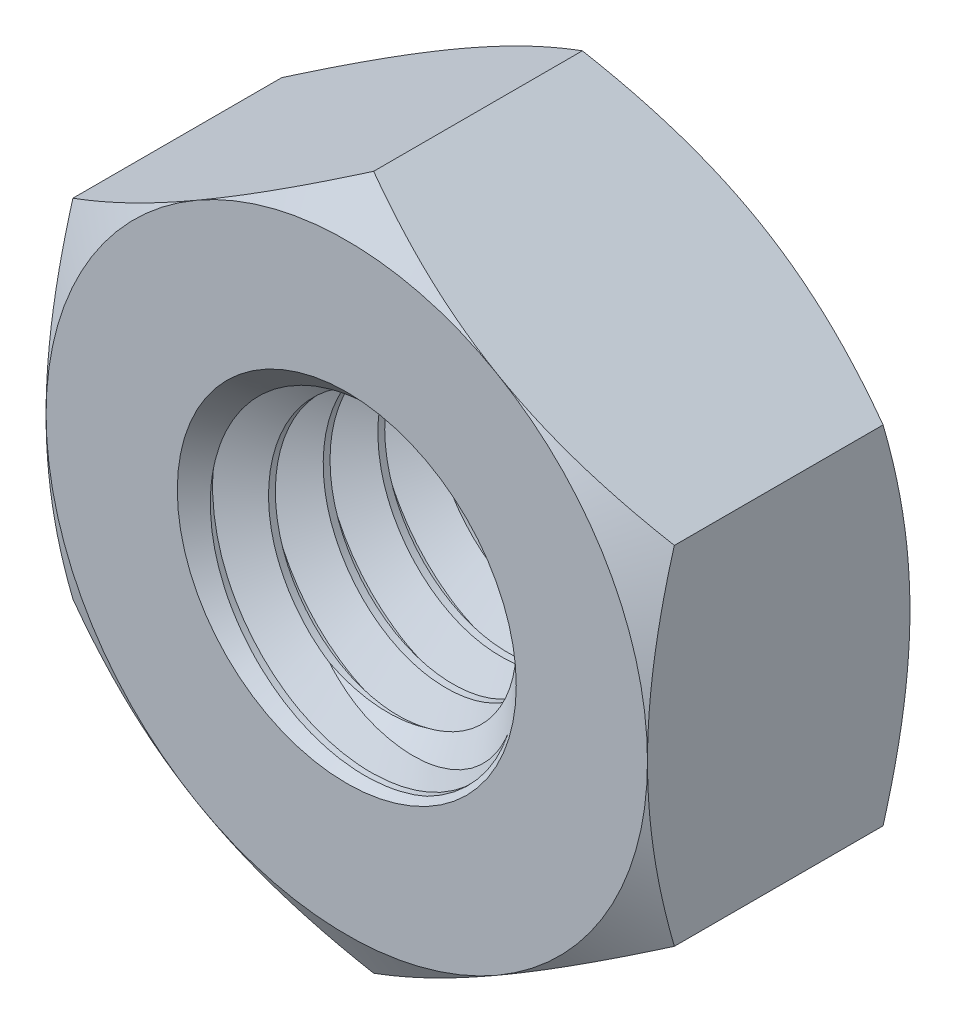
from build123d import *

# Parameters (mm, degrees)
EXTRUDE1_DEPTH               = 1.2
SKETCH13_R                   = 1.5
BOSS_EXTRUDE1_DEPTH          = 2.4
SKETCH7_OUTSIDE_W            = 97.236
SKETCH7_OUTSIDE_H            = 98.086
SKETCH7_OUTSIDE_R            = 2.75
EXTRUDE2_DEPTH               = 25.4
EXTRUDE2_DRAFT               = -60
MIRROR2_COPY_1_SKETCH_W      = 97.236
MIRROR2_COPY_1_SKETCH_H      = 98.086
MIRROR2_COPY_1_SKETCH_R      = 2.75
MIRROR2_COPY_1_DEPTH         = 25.4
MIRROR2_COPY_1_DRAFT         = -60
SWEEP1_PITCH                 = 0.5
SKETCH15_R                   = 1.55
CUT_EXTRUDE4_OTHER_WAY_DEPTH = 6.104590001
CUT_EXTRUDE4_OTHER_WAY_TAPER = -45
SKETCH16_R                   = 1.55
CUT_EXTRUDE5_OTHER_WAY_DEPTH = 5.837957664
CUT_EXTRUDE5_OTHER_WAY_TAPER = -45


with BuildPart() as part:
    # Sketch1 → Extrude1 (new, symmetric)
    with BuildSketch(Plane.XY):
        Polygon((-2.75, 1.58771324), (-2.75, -1.58771324), (0, -3.175426481), (2.75, -1.58771324), (2.75, 1.58771324), (0, 3.175426481), align=None)
    extrude(amount=EXTRUDE1_DEPTH, both=True)

    # Cut-Extrude2 cone 1 section (through the dimple's axis) → Cut-Extrude2 (revolve, cut)
    with BuildSketch(Plane(origin=(0, 0, 1.2), x_dir=(0, -1, 0), z_dir=(1, 0, 0))):
        Polygon((0, 0), (1.5, 0), (0, 1.5), align=None)
    revolve(axis=Axis((0, 0, 1.2), (0, 0, -1)), mode=Mode.SUBTRACT)

    # Cut-Extrude3 cone 1 section (through the dimple's axis) → Cut-Extrude3 (revolve, cut)
    with BuildSketch(Plane(origin=(0, 0, -1.2), x_dir=(0, 1, 0), z_dir=(1, 0, 0))):
        Polygon((0, 0), (1.5, 0), (0, 1.5), align=None)
    revolve(axis=Axis((0, 0, -1.2), (0, 0, 1)), mode=Mode.SUBTRACT)


with BuildPart() as body_2:
    # Sketch13 → Boss-Extrude1 (new body)
    with BuildSketch(Plane(origin=(0, 0, -1.2), x_dir=(-1, 0, 0), z_dir=(0, 0, -1))):
        Circle(SKETCH13_R)
    extrude(amount=-BOSS_EXTRUDE1_DEPTH)


with BuildPart() as part_1:
    add(part.part)

    # Combine1: cut body 2
    add(body_2.part, mode=Mode.SUBTRACT)


with BuildPart() as extrude2_tool:
    # Sketch7 outside → Extrude2 (with draft: the straight prism first)
    with BuildSketch(Plane.XY.offset(1.2)):
        Rectangle(SKETCH7_OUTSIDE_W, SKETCH7_OUTSIDE_H)
        Circle(SKETCH7_OUTSIDE_R, mode=Mode.SUBTRACT)
    extrude(amount=-EXTRUDE2_DEPTH)
    # Extrude2: the draft: its side faces are tilted about the plane it starts from
    extrude2_sides = [extrude2_tool.faces().sort_by_distance(p)[0] for p in [
        (0, -49.043, -11.5),
        (48.618, 0, -11.5),
        (0, 49.043, -11.5),
        (-48.618, 0, -11.5),
        (-2.75, 0, -11.5),
    ]]
    draft(extrude2_sides, Plane.XY.offset(1.2), EXTRUDE2_DRAFT)


with BuildPart() as part_2:
    add(part_1.part)

    # Extrude2: cut by extrude2_tool
    add(extrude2_tool.part, mode=Mode.SUBTRACT)


with BuildPart() as mirror2_copy_1_tool:
    # Mirror2 copy 1 sketch → Mirror2 copy 1 (with draft: the straight prism first)
    with BuildSketch(Plane(origin=(0, 0, -1.2), x_dir=(1, 0, 0), z_dir=(0, 0, -1))):
        Rectangle(MIRROR2_COPY_1_SKETCH_W, MIRROR2_COPY_1_SKETCH_H)
        Circle(MIRROR2_COPY_1_SKETCH_R, mode=Mode.SUBTRACT)
    extrude(amount=-MIRROR2_COPY_1_DEPTH)
    # Mirror2 copy 1: the draft: its side faces are tilted about the plane it starts from
    mirror2_copy_1_sides = [mirror2_copy_1_tool.faces().sort_by_distance(p)[0] for p in [
        (0, -49.043, 11.5),
        (48.618, 0, 11.5),
        (0, 49.043, 11.5),
        (-48.618, 0, 11.5),
        (-2.75, 0, 11.5),
    ]]
    draft(mirror2_copy_1_sides, Plane(origin=(0, 0, -1.2), x_dir=(1, 0, 0), z_dir=(0, 0, -1)), MIRROR2_COPY_1_DRAFT)


with BuildPart() as part_3:
    add(part_2.part)

    # Mirror2 copy 1: cut by mirror2_copy_1_tool
    add(mirror2_copy_1_tool.part, mode=Mode.SUBTRACT)

    # Sweep1: the profile of Sketch12 profile screwed along a right-hand helix of 5.8 turns, 6 arcs to a turn; built about Z, then put on its axis
    sweep1_z = Axis((0, 0, 0), (0, 0, 1))
    sweep1_corners = [(1.5003, 0, -0.437673205), (1.5003, 0, 0.000173205), (1.175240474, 0, -0.1875), (1.175240474, 0, -0.25)]
    with BuildLine(mode=Mode.PRIVATE) as sweep1_profile:
        Line(sweep1_corners[0], sweep1_corners[1])
        Line(sweep1_corners[1], sweep1_corners[2])
        Line(sweep1_corners[2], sweep1_corners[3])
        Line(sweep1_corners[3], sweep1_corners[0])
    sweep1_cap = Face(sweep1_profile.wire())
    sweep1_turn_angles = [0, 30, 60, 90, 120, 150, 180, 210, 240, 270, 300, 330, 360]
    sweep1_turn_weights = [1, 0.8660254037844387, 1, 0.8660254037844387, 1, 0.8660254037844387, 1, 0.8660254037844387, 1, 0.8660254037844387, 1, 0.8660254037844387, 1]
    sweep1_turn_rails = [Edge.make_bspline([Vector(p[0], p[1], 0).rotate(sweep1_z, sweep1_turn_angles[k]) / sweep1_turn_weights[k] + Vector(0, 0, p[2] + SWEEP1_PITCH * sweep1_turn_angles[k] / 360) for k in range(13)], [0, 0, 0, 1, 1, 2, 2, 3, 3, 4, 4, 5, 5, 6, 6, 6], 2, sweep1_turn_weights) for p in sweep1_corners]
    sweep1_turn_sides = [Face.make_surface_from_curves(sweep1_turn_rails[p[0]], sweep1_turn_rails[p[1]]) for p in [(0, 1), (1, 2), (2, 3), (3, 0)]]
    sweep1_last_angles = [1800, 1830, 1860, 1890, 1920, 1950, 1980, 2010, 2040, 2064, 2088]
    sweep1_last_weights = [1, 0.8660254037844387, 1, 0.8660254037844387, 1, 0.8660254037844387, 1, 0.8660254037844387, 1, 0.9135454576425831, 1]
    sweep1_last_rails = [Edge.make_bspline([Vector(p[0], p[1], 0).rotate(sweep1_z, sweep1_last_angles[k]) / sweep1_last_weights[k] + Vector(0, 0, p[2] + SWEEP1_PITCH * sweep1_last_angles[k] / 360) for k in range(11)], [0, 0, 0, 1, 1, 2, 2, 3, 3, 4, 4, 5, 5, 5], 2, sweep1_last_weights) for p in sweep1_corners]
    sweep1_last_sides = [Face.make_surface_from_curves(sweep1_last_rails[p[0]], sweep1_last_rails[p[1]]) for p in [(0, 1), (1, 2), (2, 3), (3, 0)]]
    sweep1 = Plane(origin=(0, 0, -1.2), x_dir=(0, 1, 0), z_dir=(0, 0, 1)) * Solid(Shell([*[p.moved(Location((0, 0, SWEEP1_PITCH * i))) for i in range(5) for p in sweep1_turn_sides], *sweep1_last_sides, sweep1_cap, sweep1_cap.rotate(sweep1_z, 2088).moved(Location((0, 0, SWEEP1_PITCH * 2088 / 360)))]))
    add(sweep1)

    # Cut-Extrude4 cone 1 section (through the dimple's axis) → Cut-Extrude4 (revolve, cut)
    with BuildSketch(Plane(origin=(0, 0, -1.2), x_dir=(0, 1, 0), z_dir=(1, 0, 0))):
        Polygon((0, 0), (1.55, 0), (0, 1.55), align=None)
    revolve(axis=Axis((0, 0, -1.2), (0, 0, 1)), mode=Mode.SUBTRACT)

    # Sketch15 → Cut-Extrude4 other way (cut)
    with BuildSketch(Plane(origin=(0, 0, -1.2), x_dir=(-1, 0, 0), z_dir=(0, 0, -1))):
        Circle(SKETCH15_R)
    extrude(amount=CUT_EXTRUDE4_OTHER_WAY_DEPTH, taper=CUT_EXTRUDE4_OTHER_WAY_TAPER, mode=Mode.SUBTRACT)

    # Cut-Extrude5 cone 1 section (through the dimple's axis) → Cut-Extrude5 (revolve, cut)
    with BuildSketch(Plane(origin=(0, 0, 1.2), x_dir=(0, -1, 0), z_dir=(1, 0, 0))):
        Polygon((0, 0), (1.55, 0), (0, 1.55), align=None)
    revolve(axis=Axis((0, 0, 1.2), (0, 0, -1)), mode=Mode.SUBTRACT)

    # Sketch16 → Cut-Extrude5 other way (cut)
    with BuildSketch(Plane.XY.offset(1.2)):
        Circle(SKETCH16_R)
    extrude(amount=CUT_EXTRUDE5_OTHER_WAY_DEPTH, taper=CUT_EXTRUDE5_OTHER_WAY_TAPER, mode=Mode.SUBTRACT)


solid = part_3.part
